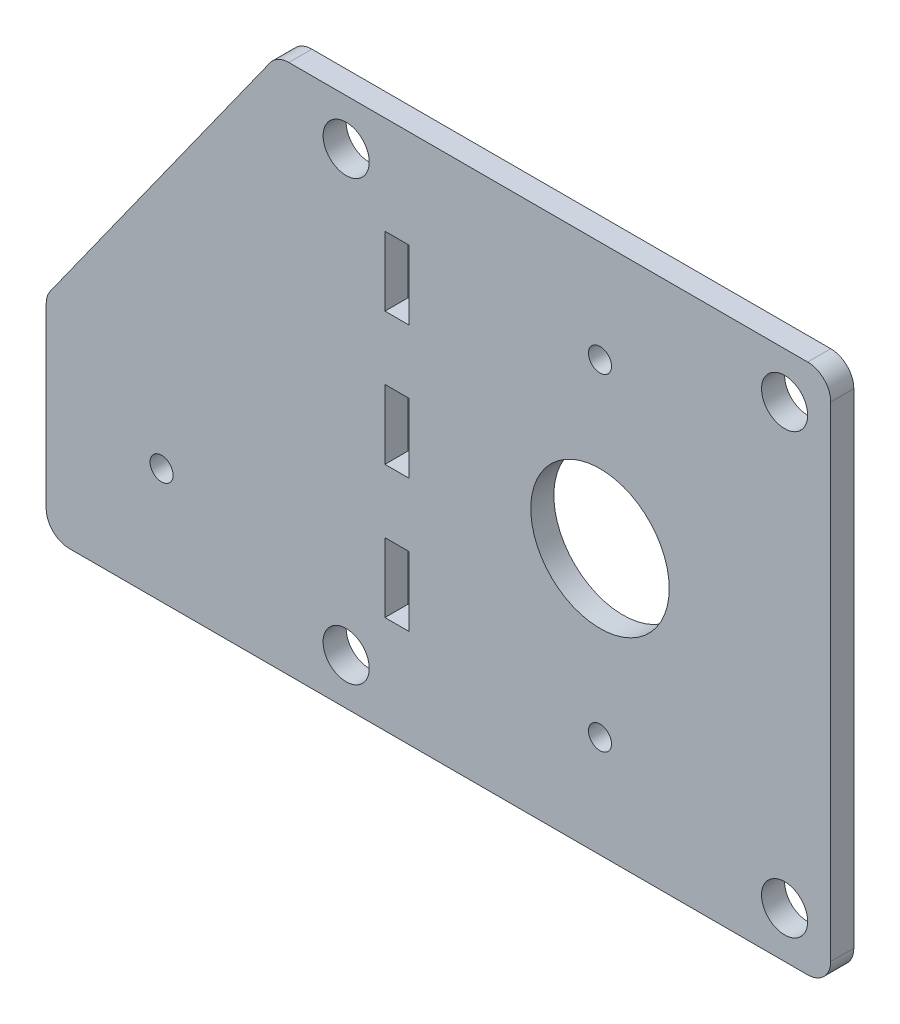
from build123d import *

# Parameters (mm, degrees)
SKETCH1_W           = 215.9
SKETCH1_H           = 146.05
SKETCH1_R           = 6.35
SKETCH1_R_2         = 19.05
SKETCH1_R_3         = 3.175
SKETCH1_W_2         = 6.604
SKETCH1_H_2         = 19.05
BOSS_EXTRUDE1_DEPTH = 3.175
SKETCH2_R           = 3.175
CUT_EXTRUDE1_DEPTH  = 170.111599617
FILLET1_R           = 6.35


with BuildPart() as part:
    # Sketch1 → Boss-Extrude1 (new, symmetric)
    with BuildSketch(Plane.XY):
        with Locations((-44.45, 0)):
            Rectangle(SKETCH1_W, SKETCH1_H)
        with Locations((50.8, 60.325)):
            Circle(SKETCH1_R, mode=Mode.SUBTRACT)
        with Locations((50.8, -60.325)):
            Circle(SKETCH1_R, mode=Mode.SUBTRACT)
        Circle(SKETCH1_R_2, mode=Mode.SUBTRACT)
        with Locations((0, 45)):
            Circle(SKETCH1_R_3, mode=Mode.SUBTRACT)
        with Locations((0, -45)):
            Circle(SKETCH1_R_3, mode=Mode.SUBTRACT)
        with Locations((-69.85, 60.325)):
            Circle(SKETCH1_R, mode=Mode.SUBTRACT)
        with Locations((-69.85, -60.325)):
            Circle(SKETCH1_R, mode=Mode.SUBTRACT)
        with Locations((-55.88, 0)):
            Rectangle(SKETCH1_W_2, SKETCH1_H_2, mode=Mode.SUBTRACT)
        with Locations((-55.88, 36.5125)):
            Rectangle(SKETCH1_W_2, SKETCH1_H_2, mode=Mode.SUBTRACT)
        with Locations((-55.88, -36.5125)):
            Rectangle(SKETCH1_W_2, SKETCH1_H_2, mode=Mode.SUBTRACT)
    extrude(amount=BOSS_EXTRUDE1_DEPTH, both=True)

    # Sketch2 → Cut-Extrude1 (cut, through all)
    with BuildSketch(Plane.XY.offset(3.175)):
        with Locations((-120.65, -41.275)):
            Circle(SKETCH2_R)
        Polygon((-88.9, 73.025), (-152.4, -15.875), (-152.4, 73.025), align=None)
    extrude(amount=-CUT_EXTRUDE1_DEPTH, mode=Mode.SUBTRACT)

    # Fillet1
    fillet1_edges = [part.edges().sort_by_distance(p)[0] for p in [
        (63.5, 73.025, 0),
        (63.5, -73.025, 0),
        (-88.9, 73.025, 0),
        (-152.4, -15.875, 0),
        (-152.4, -73.025, 0),
    ]]
    fillet(fillet1_edges, radius=FILLET1_R)


solid = part.part
